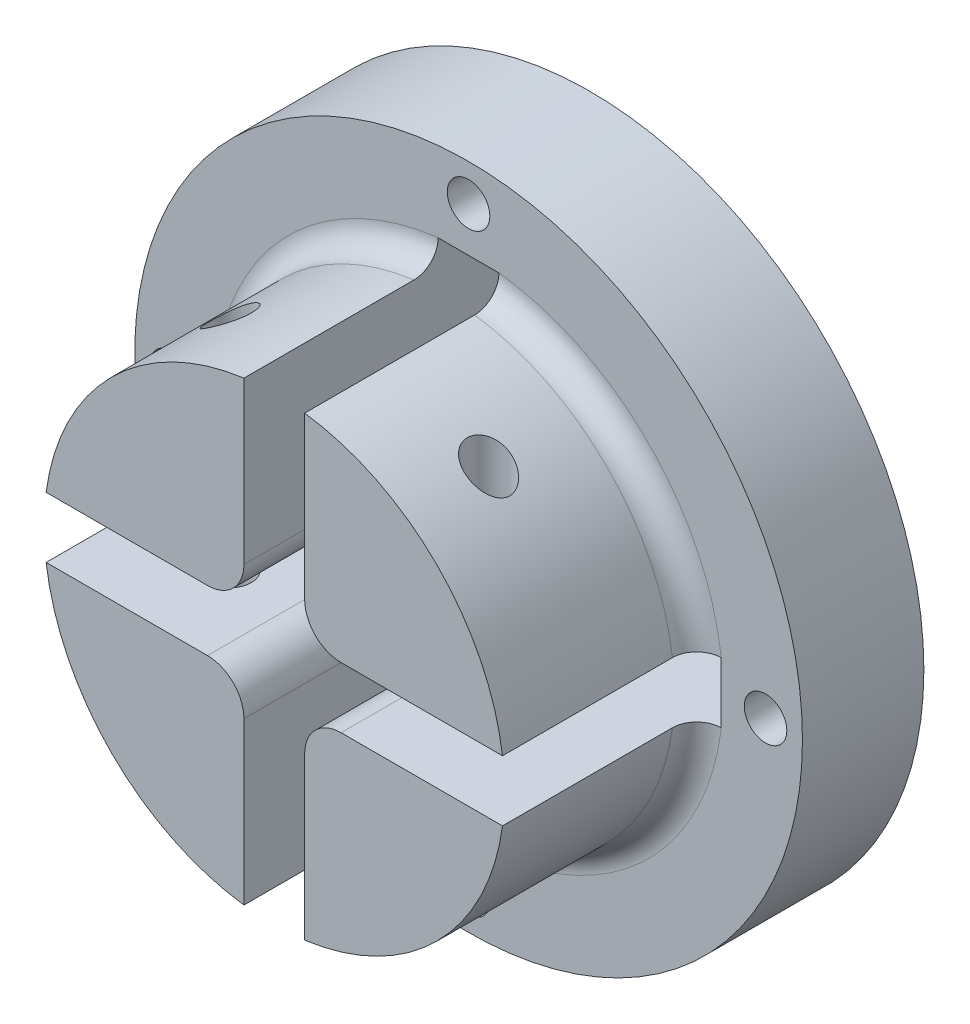
from build123d import *

# Parameters (mm, degrees)
SKETCH_1_R          = 27.5
EXTRUDE_1_DEPTH     = 10
EXTRUDE_2_DEPTH     = 16
CUT_EXTRUDE_3_DEPTH = 20
FILLET_3_R          = 2
SKETCH_7_W          = 2
SKETCH_7_H          = 5
SKETCH_7_W_2        = 5
SKETCH_7_H_2        = 2
CUT_EXTRUDE_4_DEPTH = 20
SKETCH_8_R          = 1.75
CUT_EXTRUDE_5_DEPTH = 20
SKETCH_9_R          = 1.75
CUT_EXTRUDE_6_DEPTH = 30.5


with BuildPart() as part:
    # 草图1 → 凸台-拉伸1 (new body)
    with BuildSketch(Plane.XY):
        Circle(SKETCH_1_R)
    extrude(amount=EXTRUDE_1_DEPTH)

    # 草图2 → 凸台-拉伸2 (add)
    with BuildSketch(Plane.XY.offset(10)):
        with BuildLine():
            Line((-2.5, 5.5), (-2.5, 17.5))
            Line((-2.5, 17.5), (-2.5, 18.792973669))
            ThreePointArc((-2.5, 18.792973669), (-13.405705116, 13.405705116), (-18.792973669, 2.5))
            Line((-18.792973669, 2.5), (-17.5, 2.5))
            Line((-17.5, 2.5), (-5.5, 2.5))
            ThreePointArc((-5.5, 2.5), (-3.378679656, 3.378679656), (-2.5, 5.5))
        make_face()
        with BuildLine():
            Line((17.5, -2.5), (5.5, -2.5))
            ThreePointArc((5.5, -2.5), (3.378679656, -3.378679656), (2.5, -5.5))
            Line((2.5, -5.5), (2.5, -17.5))
            Line((2.5, -17.5), (2.5, -18.792973669))
            ThreePointArc((2.5, -18.792973669), (13.405705116, -13.405705116), (18.792973669, -2.5))
            Line((18.792973669, -2.5), (17.5, -2.5))
        make_face()
        with BuildLine():
            Line((17.5, 2.5), (5.5, 2.5))
            ThreePointArc((5.5, 2.5), (3.378679656, 3.378679656), (2.5, 5.5))
            Line((2.5, 5.5), (2.5, 17.5))
            Line((2.5, 17.5), (2.5, 18.792973669))
            ThreePointArc((2.5, 18.792973669), (13.405705116, 13.405705116), (18.792973669, 2.5))
            Line((18.792973669, 2.5), (17.5, 2.5))
        make_face()
        with BuildLine():
            Line((-2.5, -17.5), (-2.5, -5.5))
            ThreePointArc((-2.5, -5.5), (-3.378679656, -3.378679656), (-5.5, -2.5))
            Line((-5.5, -2.5), (-17.5, -2.5))
            Line((-17.5, -2.5), (-18.792973669, -2.5))
            ThreePointArc((-18.792973669, -2.5), (-13.405705116, -13.405705116), (-2.5, -18.792973669))
            Line((-2.5, -18.792973669), (-2.5, -17.5))
        make_face()
    extrude(amount=EXTRUDE_2_DEPTH)

    # 草图6 → 切除-拉伸3 (cut)
    with BuildSketch(Plane.XY.offset(10)):
        Polygon((18.792973669, -2.5), (5.5, -2.5), (2.5, -2.5), (2.5, -5.5), (2.5, -18.792973669), (-2.5, -18.792973669), (-2.5, -5.5), (-2.5, -2.5), (-5.5, -2.5), (-18.792973669, -2.5), (-18.792973669, 2.5), (-5.5, 2.5), (-2.5, 2.5), (-2.5, 5.5), (-2.5, 18.792973669), (2.5, 18.792973669), (2.5, 5.5), (2.5, 2.5), (5.5, 2.5), (18.792973669, 2.5), align=None)
    extrude(amount=-CUT_EXTRUDE_3_DEPTH, mode=Mode.SUBTRACT)

    # 圆角3
    # the kernel refuses this fillet: 2 mm, written as the material it adds along each edge
    with BuildSketch(Plane(origin=(0, 0, 10), x_dir=(-0.13117570134694587, -0.9913591354177037, 0), z_dir=(-0.9913591354177037, 0.13117570134694587, 0))) as fillet_3_piece_1_section:
        with BuildLine():
            CenterArc((18.958529988 + FILLET_3_R, FILLET_3_R), FILLET_3_R, 180, 90)
            Line((18.958529988, FILLET_3_R), (18.958529988, 0))
            Line((18.958529988, 0), (18.958529988 + FILLET_3_R, 0))
        make_face()
    fillet_3_piece_1 = revolve(axis=Axis((0, 0, 10), (0, 0, 1)), revolution_arc=105.075073745, mode=Mode.PRIVATE)
    fillet_3_piece_1 = split(fillet_3_piece_1, bisect_by=Plane(origin=(2.5, -19.248904349, 10.242638579), z_dir=(1, 0, 0)), keep=Keep.TOP, mode=Mode.PRIVATE)
    fillet_3_piece_1 = split(fillet_3_piece_1, bisect_by=Plane(origin=(4.206837789, -2.5, 10.242638579), z_dir=(0, -1, 0)), keep=Keep.TOP, mode=Mode.PRIVATE)
    add(fillet_3_piece_1)
    with BuildSketch(Plane(origin=(0, 0, 10), x_dir=(-0.13117570134694623, 0.9913591354177035, 0), z_dir=(-0.9913591354177035, -0.13117570134694623, 0))) as fillet_3_piece_2_section:
        with BuildLine():
            CenterArc((18.958529988 + FILLET_3_R, -FILLET_3_R), FILLET_3_R, 90, 90)
            Line((18.958529988, -FILLET_3_R), (18.958529988, 0))
            Line((18.958529988, 0), (18.958529988 + FILLET_3_R, 0))
        make_face()
    fillet_3_piece_2 = revolve(axis=Axis((0, 0, 10), (0, 0, -1)), revolution_arc=105.075073745, mode=Mode.PRIVATE)
    fillet_3_piece_2 = split(fillet_3_piece_2, bisect_by=Plane(origin=(4.206838505, 2.5, 10.242637951), z_dir=(0, 1, 0)), keep=Keep.TOP, mode=Mode.PRIVATE)
    fillet_3_piece_2 = split(fillet_3_piece_2, bisect_by=Plane(origin=(2.5, 19.24890412, 10.242637951), z_dir=(1, 0, 0)), keep=Keep.TOP, mode=Mode.PRIVATE)
    add(fillet_3_piece_2)
    with BuildSketch(Plane(origin=(0, 0, 10), x_dir=(-0.9913591354177035, 0.13117570134694678, 0), z_dir=(0.13117570134694678, 0.9913591354177035, 0))) as fillet_3_piece_3_section:
        with BuildLine():
            CenterArc((18.958529988 + FILLET_3_R, FILLET_3_R), FILLET_3_R, 180, 90)
            Line((18.958529988, FILLET_3_R), (18.958529988, 0))
            Line((18.958529988, 0), (18.958529988 + FILLET_3_R, 0))
        make_face()
    fillet_3_piece_3 = revolve(axis=Axis((0, 0, 10), (0, 0, 1)), revolution_arc=105.075073745, mode=Mode.PRIVATE)
    fillet_3_piece_3 = split(fillet_3_piece_3, bisect_by=Plane(origin=(-19.248904349, -2.5, 10.242638579), z_dir=(0, -1, 0)), keep=Keep.TOP, mode=Mode.PRIVATE)
    fillet_3_piece_3 = split(fillet_3_piece_3, bisect_by=Plane(origin=(-2.5, -4.206837789, 10.242638579), z_dir=(-1, 0, 0)), keep=Keep.TOP, mode=Mode.PRIVATE)
    add(fillet_3_piece_3)
    with BuildSketch(Plane(origin=(0, 0, 10), x_dir=(0.13117570134694595, 0.9913591354177037, 0), z_dir=(0.9913591354177037, -0.13117570134694595, 0))) as fillet_3_piece_4_section:
        with BuildLine():
            CenterArc((18.958529988 + FILLET_3_R, FILLET_3_R), FILLET_3_R, 180, 90)
            Line((18.958529988, FILLET_3_R), (18.958529988, 0))
            Line((18.958529988, 0), (18.958529988 + FILLET_3_R, 0))
        make_face()
    fillet_3_piece_4 = revolve(axis=Axis((0, 0, 10), (0, 0, 1)), revolution_arc=105.075073745, mode=Mode.PRIVATE)
    fillet_3_piece_4 = split(fillet_3_piece_4, bisect_by=Plane(origin=(-2.5, 19.248904349, 10.242638579), z_dir=(-1, 0, 0)), keep=Keep.TOP, mode=Mode.PRIVATE)
    fillet_3_piece_4 = split(fillet_3_piece_4, bisect_by=Plane(origin=(-4.206837789, 2.5, 10.242638579), z_dir=(0, 1, 0)), keep=Keep.TOP, mode=Mode.PRIVATE)
    add(fillet_3_piece_4)

    # 草图7 → 切除-拉伸4 (cut)
    with BuildSketch(Plane(origin=(0, 0, 0), x_dir=(-1, 0, 0), z_dir=(0, 0, -1))):
        with Locations((19.792973669, 0)):
            Rectangle(SKETCH_7_W, SKETCH_7_H)
        with Locations((0, -19.792973669)):
            Rectangle(SKETCH_7_W_2, SKETCH_7_H_2)
        with Locations((-19.792973669, 0)):
            Rectangle(SKETCH_7_W, SKETCH_7_H)
        with Locations((0, 19.792973669)):
            Rectangle(SKETCH_7_W_2, SKETCH_7_H_2)
    extrude(amount=-CUT_EXTRUDE_4_DEPTH, mode=Mode.SUBTRACT)

    # 草图8 → 切除-拉伸5 (cut)
    with BuildSketch(Plane.XY.offset(10)):
        with Locations((0, 24.460175936)):
            Circle(SKETCH_8_R)
        with Locations((24.460175936, 0)):
            Circle(SKETCH_8_R)
        with Locations((0, -24.460175936)):
            Circle(SKETCH_8_R)
        with Locations((-24.460175936, 0)):
            Circle(SKETCH_8_R)
    extrude(amount=-CUT_EXTRUDE_5_DEPTH, mode=Mode.SUBTRACT)

    # 草图9 → 切除-拉伸6 (cut, symmetric)
    with BuildSketch(Plane(origin=(0, 0, 0), x_dir=(1, 0, 0), z_dir=(0, 1, 0))):
        with Locations(Location((-10.646486834, -19, 0), (0, 0, 270))):
            Circle(SKETCH_9_R)
        with Locations(Location((10.646486834, -19, 0), (0, 0, 270))):
            Circle(SKETCH_9_R)
    extrude(amount=CUT_EXTRUDE_6_DEPTH, both=True, mode=Mode.SUBTRACT)


solid = part.part
